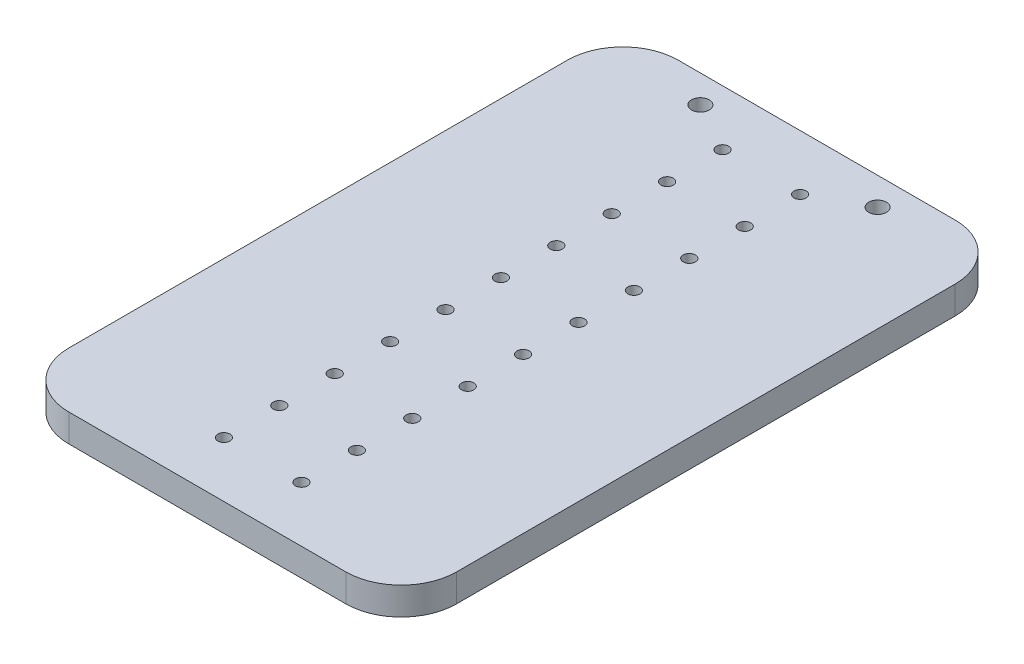
from build123d import *

# Parameters (mm, degrees)
SKETCH_1_W      = 70
SKETCH_1_H      = 110
SKETCH_1_R      = 1.6
SKETCH_1_R_2    = 1.1
EXTRUDE_1_DEPTH = 5
FILLET_1_R      = 10


with BuildPart() as part:
    # 草图1 → 凸台-拉伸1 (new body)
    with BuildSketch(Plane(origin=(0, 0, 0), x_dir=(1, 0, 0), z_dir=(0, 1, 0))):
        Rectangle(SKETCH_1_W, SKETCH_1_H)
        with Locations((-16, 50)):
            Circle(SKETCH_1_R, mode=Mode.SUBTRACT)
        with Locations((-7, 35)):
            Circle(SKETCH_1_R_2, mode=Mode.SUBTRACT)
        with Locations((-7, -45)):
            Circle(SKETCH_1_R_2, mode=Mode.SUBTRACT)
        with Locations((7, -45)):
            Circle(SKETCH_1_R_2, mode=Mode.SUBTRACT)
        with Locations((7, 35)):
            Circle(SKETCH_1_R_2, mode=Mode.SUBTRACT)
        with Locations((16, 50)):
            Circle(SKETCH_1_R, mode=Mode.SUBTRACT)
        with Locations((-7, 25)):
            Circle(SKETCH_1_R_2, mode=Mode.SUBTRACT)
        with Locations((7, 25)):
            Circle(SKETCH_1_R_2, mode=Mode.SUBTRACT)
        with Locations((-7, 15)):
            Circle(SKETCH_1_R_2, mode=Mode.SUBTRACT)
        with Locations((7, 15)):
            Circle(SKETCH_1_R_2, mode=Mode.SUBTRACT)
        with Locations((-7, 5)):
            Circle(SKETCH_1_R_2, mode=Mode.SUBTRACT)
        with Locations((7, 5)):
            Circle(SKETCH_1_R_2, mode=Mode.SUBTRACT)
        with Locations((-7, -5)):
            Circle(SKETCH_1_R_2, mode=Mode.SUBTRACT)
        with Locations((7, -5)):
            Circle(SKETCH_1_R_2, mode=Mode.SUBTRACT)
        with Locations((-7, -15)):
            Circle(SKETCH_1_R_2, mode=Mode.SUBTRACT)
        with Locations((7, -15)):
            Circle(SKETCH_1_R_2, mode=Mode.SUBTRACT)
        with Locations((-7, -25)):
            Circle(SKETCH_1_R_2, mode=Mode.SUBTRACT)
        with Locations((7, -25)):
            Circle(SKETCH_1_R_2, mode=Mode.SUBTRACT)
        with Locations((-7, -35)):
            Circle(SKETCH_1_R_2, mode=Mode.SUBTRACT)
        with Locations((7, -35)):
            Circle(SKETCH_1_R_2, mode=Mode.SUBTRACT)
        with Locations((-7, 45)):
            Circle(SKETCH_1_R_2, mode=Mode.SUBTRACT)
        with Locations((7, 45)):
            Circle(SKETCH_1_R_2, mode=Mode.SUBTRACT)
    extrude(amount=EXTRUDE_1_DEPTH)

    # 圆角1
    fillet_1_edges = [part.edges().sort_by_distance(p)[0] for p in [
        (-35, 2.5, 55),
        (35, 2.5, 55),
        (35, 2.5, -55),
        (-35, 2.5, -55),
    ]]
    fillet(fillet_1_edges, radius=FILLET_1_R)


solid = part.part
